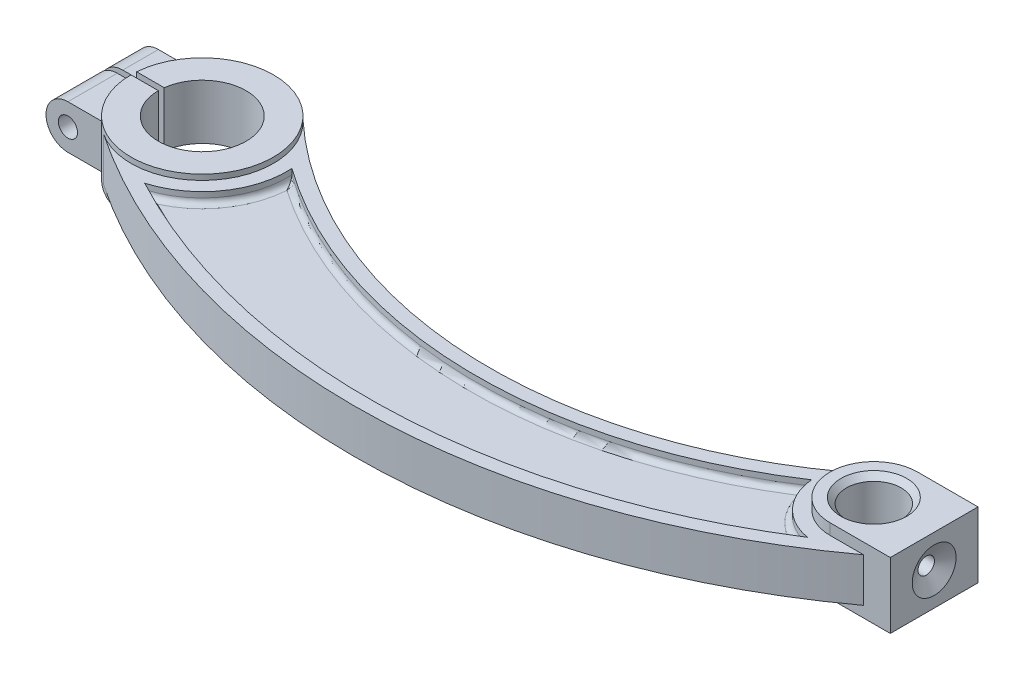
from build123d import *
from build123d.topology import SkipClean

# Parameters (mm, degrees)
SKETCH_1_R               = 26
EXTRUDE_1_DEPTH          = 10
EXTRUDE_2_DEPTH          = 12
EXTRUDE_3_DEPTH          = 4
EXTRUDE_4_DEPTH          = 8
EXTRUDE_START            = -15
EXTRUDE_5_DEPTH          = 33
SKETCH_6_R               = 3.5
CUT_EXTRUDE_1_DEPTH      = 271.867126097
SKETCH_7_R               = 16
CUT_EXTRUDE_2_DEPTH      = 275.960646248
CUT_EXTRUDE_3_DEPTH      = 275.341679271
CUT_EXTRUDE_3_DEPTH_BACK = 275.341679271
SKETCH_8_W               = 47.47924493
SKETCH_8_H               = 2
SKETCH_9_R               = 10
CUT_EXTRUDE_4_DEPTH      = 276.127892052
CHAMFER_1_SIZE           = 2
FILLET_1_R               = 2


# Read off the part's stored shape, not the designer's step: Ø6.0mm 暗销孔1
with BuildPart() as part:
    # 草图1 → 凸台-拉伸1 (new, symmetric)
    with BuildSketch(Plane(origin=(0, 0, 0), x_dir=(1, 0, 0), z_dir=(0, 1, 0))):
        with Locations(Location((0, 0, 0), (0, 0, 270))):
            Circle(SKETCH_1_R)
    extrude(amount=EXTRUDE_1_DEPTH, both=True)



with BuildPart() as body_2:
    # 草图2 → 凸台-拉伸2 (new, symmetric)
    with BuildSketch(Plane(origin=(0, 0, 0), x_dir=(1, 0, 0), z_dir=(0, 1, 0))):
        with BuildLine():
            Line((245, 16), (267, 16))
            Line((267, 16), (267, -16))
            Line((267, -16), (245, -16))
            ThreePointArc((245, -16), (229, 0), (245, 16))
        make_face()
    extrude(amount=EXTRUDE_2_DEPTH, both=True)


with BuildPart() as part_1:
    add(part.part)

    add(body_2.part)  # 凸台-拉伸3 merges body 2
    # 草图3 → 凸台-拉伸3 (add, symmetric)
    with BuildSketch(Plane(origin=(0, 0, 0), x_dir=(1, 0, 0), z_dir=(0, 1, 0))):
        with BuildLine():
            Line((245, -16), (257.248496817, -16))
            ThreePointArc((257.248496817, -16), (122.236247563, -61.840572391), (-14.536770014, -21.556491309))
            ThreePointArc((-14.536770014, -21.556491309), (20.358485161, -16.17195356), (17.708836414, 19.036730624))
            ThreePointArc((17.708836414, 19.036730624), (125.0222059, -25.075347424), (234.842372308, 12.362143814))
            ThreePointArc((234.842372308, 12.362143814), (229.936894394, -5.394705691), (245, -16))
        make_face()
    extrude(amount=EXTRUDE_3_DEPTH, both=True)

    # 草图4 → 凸台-拉伸4 (add, symmetric)
    with SkipClean():  # the faces are left unmerged after this step: merging them gives an invalid solid
        with BuildSketch(Plane(origin=(0, 0, 0), x_dir=(1, 0, 0), z_dir=(0, 1, 0))):
            with BuildLine():
                Line((257.248496817, -16), (245, -16))
                ThreePointArc((245, -16), (229.936894394, -5.394705691), (234.842372308, 12.362143814))
                ThreePointArc((234.842372308, 12.362143814), (125.0222059, -25.075347424), (17.708836414, 19.036730624))
                ThreePointArc((17.708836414, 19.036730624), (20.358485161, -16.17195356), (-14.536770014, -21.556491309))
                ThreePointArc((-14.536770014, -21.556491309), (122.236247563, -61.840572391), (257.248496817, -16))
            make_face()
            with BuildLine():
                ThreePointArc((224.078129878, -1.809792966), (229.571334836, -14.24627289), (241.531331279, -20.711550818))
                ThreePointArc((241.531331279, -20.711550818), (126.363618071, -56.716382465), (8.753490395, -29.738466771))
                ThreePointArc((8.753490395, -29.738466771), (25.337079445, -17.861478248), (30.950628442, 1.74888508))
                ThreePointArc((30.950628442, 1.74888508), (126.959850958, -30.124394673), (224.078129878, -1.809792966))
            make_face(mode=Mode.SUBTRACT)
        extrude(amount=EXTRUDE_4_DEPTH, both=True)
    add(part_1.part.scale(1), mode=Mode.REPLACE)  # the faces are merged on a copy

    # 草图5 → 凸台-拉伸5 (add)
    with BuildSketch(Plane.XY.offset(EXTRUDE_START)):
        with BuildLine():
            Line((0, -8), (-31, -8))
            ThreePointArc((-31, -8), (-39, 0), (-31, 8))
            Line((-31, 8), (0, 8))
            ThreePointArc((0, 8), (8, 0), (0, -8))
        make_face()
    extrude(amount=EXTRUDE_5_DEPTH)

    # 草图6 → 切除-拉伸1 (cut, through all)
    with BuildSketch(Plane.XY.offset(18)):
        with Locations((-31, 0)):
            Circle(SKETCH_6_R)
    extrude(amount=-CUT_EXTRUDE_1_DEPTH, mode=Mode.SUBTRACT)

    # 草图7 → 切除-拉伸2 (cut, through all)
    with BuildSketch(Plane(origin=(0, 10, 0), x_dir=(1, 0, 0), z_dir=(0, 1, 0))):
        with Locations(Location((0, 0, 0), (0, 0, 270))):
            Circle(SKETCH_7_R)
    extrude(amount=-CUT_EXTRUDE_2_DEPTH, mode=Mode.SUBTRACT)

    # 草图8 → 切除-拉伸3 (cut, two sides: drawn at the far end of the back side and taken through both)
    with BuildSketch(Plane(origin=(0, 0, 0), x_dir=(1, 0, 0), z_dir=(0, 1, 0)).offset(-CUT_EXTRUDE_3_DEPTH_BACK)):
        with Locations((-23.739622465, 1)):
            Rectangle(SKETCH_8_W, SKETCH_8_H)
    extrude(amount=CUT_EXTRUDE_3_DEPTH + CUT_EXTRUDE_3_DEPTH_BACK, mode=Mode.SUBTRACT)

    # 草图9 → 切除-拉伸4 (cut, through all)
    with BuildSketch(Plane(origin=(0, 12, 0), x_dir=(1, 0, 0), z_dir=(0, 1, 0))):
        with Locations(Location((245, 0, 0), (0, 0, 270))):
            Circle(SKETCH_9_R)
    extrude(amount=-CUT_EXTRUDE_4_DEPTH, mode=Mode.SUBTRACT)

    # 倒角1
    chamfer_1_edges = [part_1.edges().sort_by_distance(p)[0] for p in [
        (245, -12, -10),
        (245, 12, -10),
    ]]
    chamfer(chamfer_1_edges, length=CHAMFER_1_SIZE)

    # 圆角1
    fillet_1_edges = [part_1.edges().sort_by_distance(p)[0] for p in [
        (25.337079445, -4, 17.861478248),
        (126.959850958, -4, 30.124394673),
        (229.571334836, -4, 14.24627289),
        (126.363618071, -4, 56.716382465),
        (126.363618071, 4, 56.716382465),
        (229.571334836, 4, 14.24627289),
        (126.959850958, 4, 30.124394673),
        (25.337079445, 4, 17.861478248),
    ]]
    fillet(fillet_1_edges, radius=FILLET_1_R)

    # Ø6.0mm 暗销孔1 outline → Ø6.0mm 暗销孔1 (revolve, cut)
    with BuildSketch(Plane.YX):
        Polygon((0, 254.53912622), (3, 254.53912622), (3, 264.113248654), (8, 267), (0, 267), align=None)
    revolve(axis=Axis((0, 0, 0), (1, 0, 0)), mode=Mode.SUBTRACT)


solid = part_1.part
